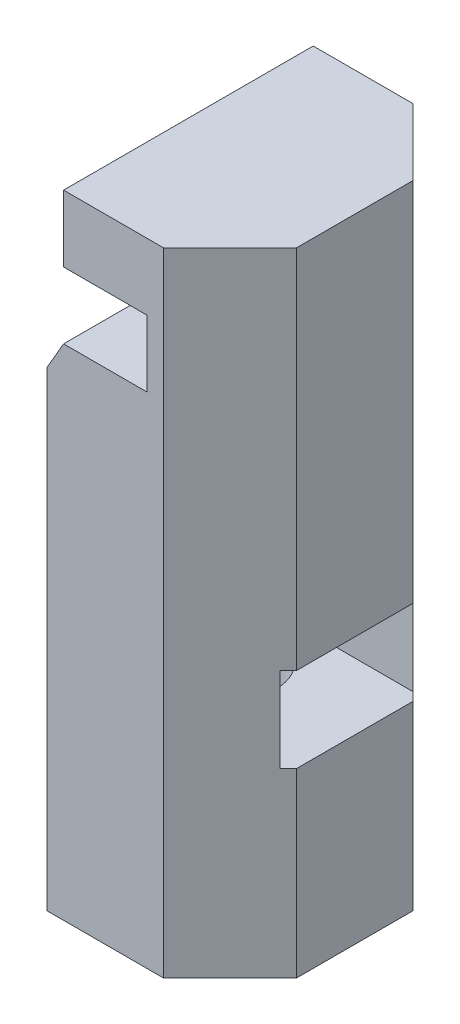
from build123d import *

# Parameters (mm, degrees)
BOSS_EXTRUDE1_DEPTH = 7.5
SKETCH2_R           = 5.25
CUT_EXTRUDE1_DEPTH  = 6
SKETCH4_R           = 2.75
CUT_EXTRUDE3_DEPTH  = 28
CUT_EXTRUDE4_REACH  = 36.369
SKETCH5_W           = 8
SKETCH5_H           = 5.1
CHAMFER2_SIZE       = 5
CHAMFER2_SIZE2      = 8.660254038
CHAMFER3_SIZE       = 4


with BuildPart() as part:
    # Sketch1 → Boss-Extrude1 (new, symmetric)
    with BuildSketch(Plane.XY):
        Polygon((-6, 8), (4, 8), (4, -30), (-11, -30), (-11, 0), (-1, 0), (-1, 4), (-6, 4), align=None)
    extrude(amount=BOSS_EXTRUDE1_DEPTH, both=True)

    # Sketch2 → Cut-Extrude1 (cut)
    with BuildSketch(Plane.XZ.offset(30)):
        with Locations((-3.5, 0)):
            Circle(SKETCH2_R)
    extrude(amount=-CUT_EXTRUDE1_DEPTH, mode=Mode.SUBTRACT)

    # Sketch4 → Cut-Extrude3 (cut)
    with BuildSketch(Plane.XZ.offset(30)):
        with Locations((-3.5, 0)):
            Circle(SKETCH4_R)
    extrude(amount=-CUT_EXTRUDE3_DEPTH, mode=Mode.SUBTRACT)

    # Sketch5 → Cut-Extrude4 (cut, up to next)
    with BuildSketch(Plane(origin=(4, 0, 0), x_dir=(0, 0, -1), z_dir=(1, 0, 0)), mode=Mode.PRIVATE) as cut_extrude4_sk1:
        with Locations((0, -16.55)):
            Rectangle(SKETCH5_W, SKETCH5_H)
    cut_extrude4_tool1 = extrude(cut_extrude4_sk1.sketch, amount=-CUT_EXTRUDE4_REACH, mode=Mode.PRIVATE) & part.part
    add(cut_extrude4_tool1.solids().sort_by_distance((4, -16.55, 0))[0], mode=Mode.SUBTRACT)

    # Chamfer2
    chamfer2_edges = [part.edges().sort_by_distance(p)[0] for p in [
        (-11, 0, 0),
    ]]
    chamfer2_side = [part.faces().sort_by_distance(p)[0] for p in [
        (-6, 0, 0),
    ]]
    chamfer(chamfer2_edges, length=CHAMFER2_SIZE, length2=CHAMFER2_SIZE2, reference=chamfer2_side[0])

    # Chamfer3
    # the kernel refuses this chamfer: 4 mm, written as the material it takes off along each edge
    with BuildSketch(Plane(origin=(-11, -40.286731952, 7.5), x_dir=(-0.027495876610586487, 0, -0.9996219169112968), z_dir=(0, 1, 0)), Plane(origin=(-11, -40.286731952, -7.5), x_dir=(0.9996219169112968, 0, -0.027495876610586275), z_dir=(0, 1, 0))) as chamfer3_piece_1:
        Polygon((CHAMFER3_SIZE * 0.999621916911, -CHAMFER3_SIZE * 0.0274958766106), (-CHAMFER3_SIZE * 0.0274958766106, -CHAMFER3_SIZE * 0.999621916911), (0, 0), align=None)
    extrude(amount=41.913209866, mode=Mode.SUBTRACT)
    with BuildSketch(Plane(origin=(4, 18.286731952, -7.5), x_dir=(-0.9996219169112968, 0, -0.027495876610586275), z_dir=(0, -1, 0)), Plane(origin=(4, 18.286731952, 7.5), x_dir=(0.02749587661058638, 0, -0.9996219169112968), z_dir=(0, -1, 0))) as chamfer3_piece_2:
        Polygon((CHAMFER3_SIZE * 0.999621916911, -CHAMFER3_SIZE * 0.0274958766106), (-CHAMFER3_SIZE * 0.0274958766106, -CHAMFER3_SIZE * 0.999621916911), (0, 0), align=None)
    extrude(amount=58.573463904, mode=Mode.SUBTRACT)


solid = part.part
